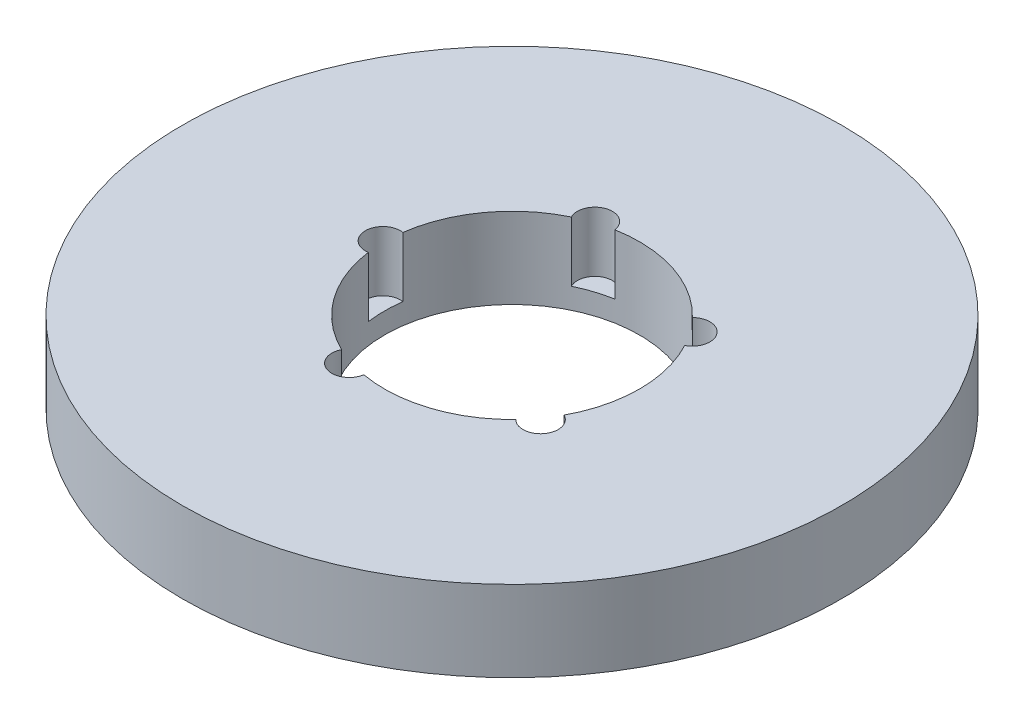
from build123d import *

# Parameters (mm, degrees)
SKETCH1_R           = 77.5
BOSS_EXTRUDE1_DEPTH = 19
SKETCH2_R           = 30
CUT_EXTRUDE1_DEPTH  = 112.236235103
SKETCH3_R           = 4.119291262
CUT_EXTRUDE2_DEPTH  = 14.101641556
CIRPATTERN1_COUNT   = 5


with BuildPart() as part:
    # Sketch1 → Boss-Extrude1 (new body)
    with BuildSketch(Plane(origin=(0, 0, 0), x_dir=(1, 0, 0), z_dir=(0, 1, 0))):
        Circle(SKETCH1_R)
    extrude(amount=BOSS_EXTRUDE1_DEPTH)

    # Sketch2 → Cut-Extrude1 (cut, through all)
    with BuildSketch(Plane(origin=(0, 0, 0), x_dir=(1, 0, 0), z_dir=(0, 1, 0))):
        Circle(SKETCH2_R)
    extrude(amount=CUT_EXTRUDE1_DEPTH, mode=Mode.SUBTRACT)

    # Sketch3 → Cut-Extrude2 (cut)
    with BuildSketch(Plane(origin=(0, 19, 0), x_dir=(1, 0, 0), z_dir=(0, 1, 0))):
        with Locations((-30.3623525, 0)):
            Circle(SKETCH3_R)
    cut_extrude2 = extrude(amount=-CUT_EXTRUDE2_DEPTH, mode=Mode.SUBTRACT)

    # CirPattern1: Cut-Extrude2 ×5 about axis
    cirpattern1_axis = Axis((0, 0, 0), (0, 1, 0))
    for i in range(1, CIRPATTERN1_COUNT):
        add(cut_extrude2.rotate(cirpattern1_axis, i * 360 / CIRPATTERN1_COUNT), mode=Mode.SUBTRACT)


solid = part.part
